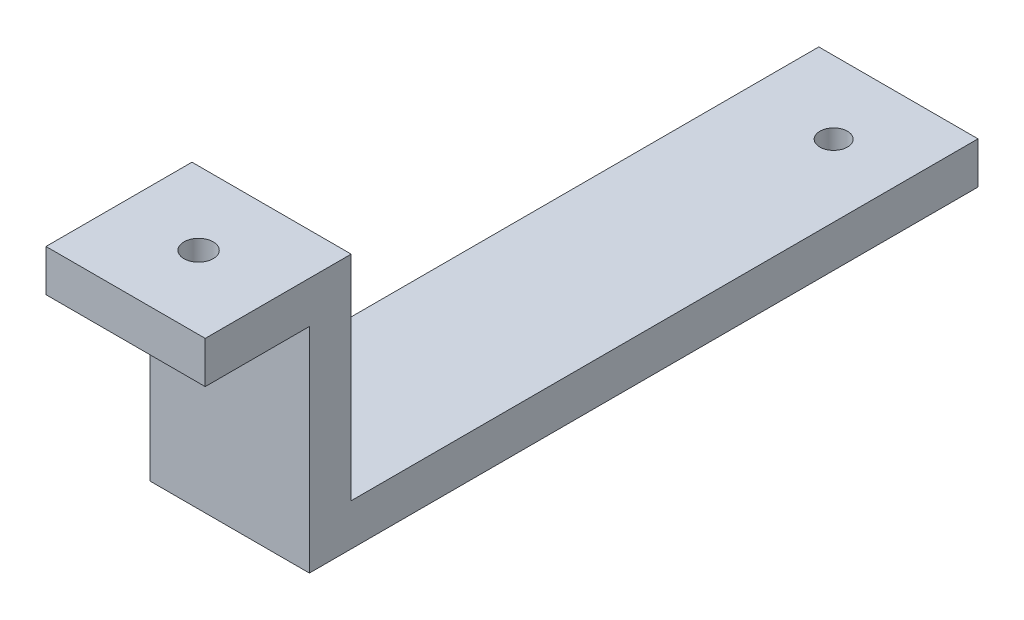
from build123d import *

# Parameters (mm, degrees)
EXTRUDE_THIN1_DEPTH = 38.1
SKETCH2_R           = 3.5
CUT_EXTRUDE1_DEPTH  = 199.45691472
SKETCH4_R           = 3.3
CUT_EXTRUDE3_DEPTH  = 60


with BuildPart() as part:
    # Sketch1 → Extrude-Thin1 (new body)
    with BuildSketch(Plane(origin=(0, 0, 0), x_dir=(0, 0, -1), z_dir=(1, 0, 0))):
        Polygon((0, 0), (34.93, 0), (34.93, -51.11), (184.93, -51.11), (184.93, -61.11), (24.93, -61.11), (24.93, -10), (0, -10), align=None)
    extrude(amount=EXTRUDE_THIN1_DEPTH)

    # Sketch2 → Cut-Extrude1 (cut, through all)
    with BuildSketch(Plane(origin=(0, 0, 0), x_dir=(1, 0, 0), z_dir=(0, 1, 0))):
        with Locations((19.05, 17.465)):
            Circle(SKETCH2_R)
    extrude(amount=-CUT_EXTRUDE1_DEPTH, mode=Mode.SUBTRACT)

    # Sketch4 → Cut-Extrude3 (cut)
    with BuildSketch(Plane(origin=(0, -51.11, 0), x_dir=(1, 0, 0), z_dir=(0, 1, 0))):
        with Locations((20.897590421, 167.59354)):
            Circle(SKETCH4_R)
    extrude(amount=-CUT_EXTRUDE3_DEPTH, mode=Mode.SUBTRACT)


solid = part.part
